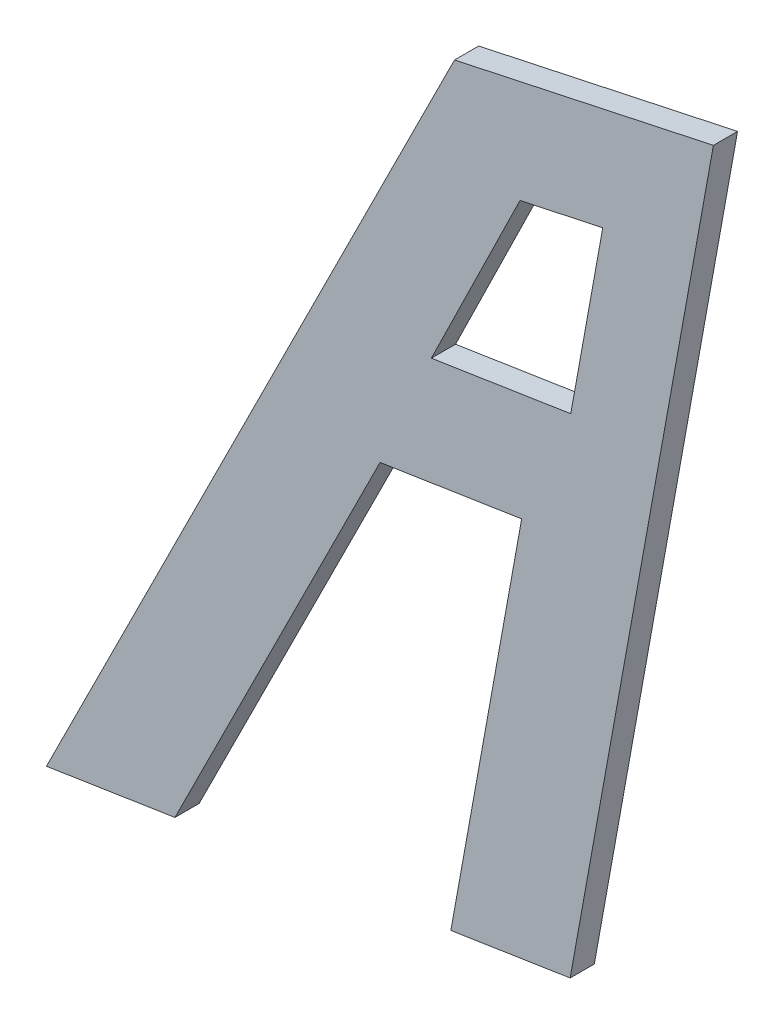
from build123d import *

# Parameters (mm, degrees)
BOSS_EXTRUDE2_DEPTH = 2.54


with BuildPart() as part:
    # Sketch10 → Boss-Extrude2 (new body)
    with BuildSketch(Plane.XY):
        Polygon((-154.272280123, 24.619929216), (-181.478173043, 18.788847691), (-224.366726901, -66.939189408), (-210.860892234, -64.84542538), (-189.305322746, -21.758949046), (-174.423275821, -19.45183547), (-181.864299283, -60.633813214), (-169.325238053, -58.689924814), align=None)
        Polygon((-183.912630652, -9.572100488), (-174.596185931, 9.440157766), (-165.899746134, 11.304079292), (-169.261389065, -7.300767885), (-181.864299283, -9.254554579), align=None, mode=Mode.SUBTRACT)
    extrude(amount=BOSS_EXTRUDE2_DEPTH)


solid = part.part
